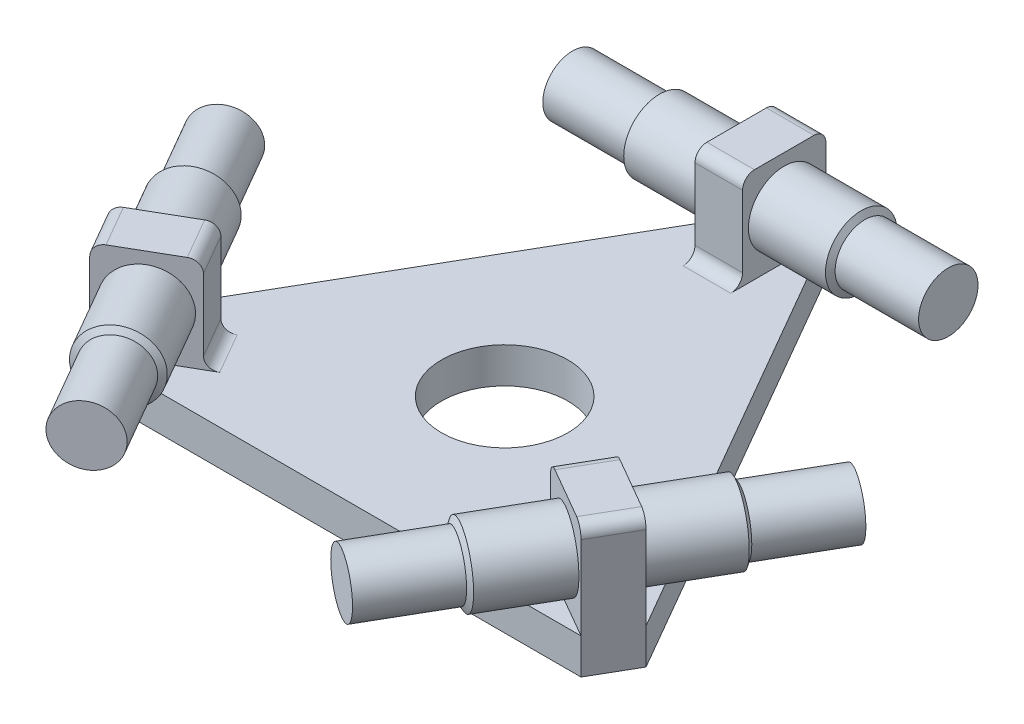
from build123d import *

# Parameters (mm, degrees)
BOSS_EXTRUDE1_DEPTH              = 3.81
F_17_32_0_53125_DIAMETER_HOLE1_D = 13.49375
BOSS_EXTRUDE2_DEPTH              = 10.16
CIRPATTERN19_COUNT               = 3
BOSS_EXTRUDE3_START              = -13.71
SKETCH6_R                        = 3.825
BOSS_EXTRUDE3_DEPTH              = 22.34
BOSS_EXTRUDE4_START              = -31.23
SKETCH7_R                        = 3.175
BOSS_EXTRUDE4_DEPTH              = 40.12
CIRPATTERN21_COUNT               = 3
CIRPATTERN28_COUNT               = 3
CHAMFER3_SIZE                    = 0.4
CHAMFER3_SIZE_2                  = 0.692820323
FILLET4_R                        = 1.27


with BuildPart() as part:
    # Sketch1 → Boss-Extrude1 (new body)
    with BuildSketch(Plane(origin=(0, 0, 0), x_dir=(1, 0, 0), z_dir=(0, 1, 0))):
        Polygon((2.54, 31.75), (-2.54, 31.75), (-28.76630657, -13.675295474), (-26.22630657, -18.074704526), (26.22630657, -18.074704526), (28.76630657, -13.675295474), align=None)
    extrude(amount=BOSS_EXTRUDE1_DEPTH)

    # 17/32 (0.53125) Diameter Hole1 (through all)
    with Locations(Plane(origin=(-6.6e-08, 3.81, -3.86e-07), x_dir=(0, 0, 1), z_dir=(0, 1, 0))):
        with Locations((0, 0)):
            Hole(F_17_32_0_53125_DIAMETER_HOLE1_D / 2)

    # Sketch5 → Boss-Extrude2 (add)
    with BuildSketch(Plane(origin=(0, 3.81, 0), x_dir=(1, 0, 0), z_dir=(0, 1, 0))):
        Polygon((-21.067340731, -9.230295474), (-28.76630657, -13.675295474), (-26.22630657, -18.074704526), (-18.527340731, -13.629704526), align=None)
    boss_extrude2 = extrude(amount=BOSS_EXTRUDE2_DEPTH)

    # CirPattern19: Boss-Extrude2 ×3 about axis
    cirpattern19_axis = Axis((0, 0, 0), (0, 1, 0))
    for i in range(1, CIRPATTERN19_COUNT):
        add(boss_extrude2.rotate(cirpattern19_axis, i * 360 / CIRPATTERN19_COUNT))

    # Sketch6 → Boss-Extrude3 (add)
    with BuildSketch(Plane(origin=(1.27, 0, 2.199704526), x_dir=(0.8660254037844383, 0, -0.5000000000000007), z_dir=(0.5000000000000007, 0, 0.8660254037844383)).offset(BOSS_EXTRUDE3_START)):
        with Locations((-27.305, 8.89)):
            Circle(SKETCH6_R)
    boss_extrude3 = extrude(amount=BOSS_EXTRUDE3_DEPTH)

    # Sketch7 → Boss-Extrude4 (add)
    with BuildSketch(Plane(origin=(5.585, 0, 9.67350376), x_dir=(0.8660254037844384, 0, -0.5000000000000007), z_dir=(0.5000000000000007, 0, 0.8660254037844384)).offset(BOSS_EXTRUDE4_START)):
        with Locations((-27.305, 8.89)):
            Circle(SKETCH7_R)
    boss_extrude4 = extrude(amount=BOSS_EXTRUDE4_DEPTH)

    # CirPattern21: Boss-Extrude3 ×3 about axis
    cirpattern21_axis = Axis((0, 0, 0), (0, 1, 0))
    for i in range(1, CIRPATTERN21_COUNT):
        add(boss_extrude3.rotate(cirpattern21_axis, i * 360 / CIRPATTERN21_COUNT))

    # CirPattern28: Boss-Extrude4 ×3 about axis
    cirpattern28_axis = Axis((0, 0, 0), (0, 1, 0))
    for i in range(1, CIRPATTERN28_COUNT):
        add(boss_extrude4.rotate(cirpattern28_axis, i * 360 / CIRPATTERN28_COUNT))

    # Chamfer3
    # the kernel refuses this chamfer: 0.692820323, 0.4 mm, written as the material it takes off along each edge
    with BuildSketch(Plane(origin=(-18.06182365, 8.89, 23.32600376), x_dir=(0.8660254037844383, 0, -0.5000000000000004), z_dir=(0, -1, 0))) as chamfer3_piece_1_section:
        Polygon((3.825, -CHAMFER3_SIZE), (3.825 - CHAMFER3_SIZE_2, 0), (3.825, 0), align=None)
    chamfer3_piece_1 = revolve(axis=Axis((-18.06182365, 8.89, 23.32600376), (0.5000000000000007, 0, 0.8660254037844383)), mode=Mode.PRIVATE)
    chamfer3_piece_1 = chamfer3_piece_1 - Plane(origin=(-18.164887991, 8.89, 23.147491086), x_dir=(0.8660254037844384, 0, -0.5000000000000007), z_dir=(-0.5000000000000007, 0, -0.8660254037844384)) * Cylinder(3.175, 16, mode=Mode.PRIVATE)
    add(chamfer3_piece_1, mode=Mode.SUBTRACT)
    with BuildSketch(Plane(origin=(-11.17, 8.89, -27.305), x_dir=(0, 0, 1), z_dir=(0, -1, 0))) as chamfer3_piece_2_section:
        Polygon((3.825, -CHAMFER3_SIZE), (3.825 - CHAMFER3_SIZE_2, 0), (3.825, 0), align=None)
    chamfer3_piece_2 = revolve(axis=Axis((-11.17, 8.89, -27.305), (-1, 0, 0)), mode=Mode.PRIVATE)
    chamfer3_piece_2 = chamfer3_piece_2 - Plane(origin=(-10.963871319, 8.89, -27.305), x_dir=(0, 0, 1), z_dir=(1, 0, 0)) * Cylinder(3.175, 16, mode=Mode.PRIVATE)
    add(chamfer3_piece_2, mode=Mode.SUBTRACT)
    with BuildSketch(Plane(origin=(11.17, 8.89, -27.305), x_dir=(0, 0, 1), z_dir=(0, -1, 0))) as chamfer3_piece_3_section:
        Polygon((3.825, CHAMFER3_SIZE), (3.825 - CHAMFER3_SIZE_2, 0), (3.825, 0), align=None)
    chamfer3_piece_3 = revolve(axis=Axis((11.17, 8.89, -27.305), (-1, 0, 0)), mode=Mode.PRIVATE)
    chamfer3_piece_3 = chamfer3_piece_3 - Plane(origin=(10.963871319, 8.89, -27.305), x_dir=(0, 0, 1), z_dir=(1, 0, 0)) * Cylinder(3.175, 16, mode=Mode.PRIVATE)
    add(chamfer3_piece_3, mode=Mode.SUBTRACT)
    with BuildSketch(Plane(origin=(29.23182365, 8.89, 3.97899624), x_dir=(-0.8660254037844392, 0, -0.49999999999999906), z_dir=(0, -1, 0))) as chamfer3_piece_4_section:
        Polygon((3.825, -CHAMFER3_SIZE), (3.825 - CHAMFER3_SIZE_2, 0), (3.825, 0), align=None)
    chamfer3_piece_4 = revolve(axis=Axis((29.23182365, 8.89, 3.97899624), (0.4999999999999995, 0, -0.8660254037844389)), mode=Mode.PRIVATE)
    chamfer3_piece_4 = chamfer3_piece_4 - Plane(origin=(29.12875931, 8.89, 4.157508914), x_dir=(-0.8660254037844389, 0, -0.49999999999999956), z_dir=(-0.49999999999999956, 0, 0.8660254037844389)) * Cylinder(3.175, 16, mode=Mode.PRIVATE)
    add(chamfer3_piece_4, mode=Mode.SUBTRACT)
    with BuildSketch(Plane(origin=(18.06182365, 8.89, 23.32600376), x_dir=(-0.8660254037844394, 0, -0.49999999999999895), z_dir=(0, -1, 0))) as chamfer3_piece_5_section:
        Polygon((3.825, CHAMFER3_SIZE), (3.825 - CHAMFER3_SIZE_2, 0), (3.825, 0), align=None)
    chamfer3_piece_5 = revolve(axis=Axis((18.06182365, 8.89, 23.32600376), (0.4999999999999995, 0, -0.8660254037844389)), mode=Mode.PRIVATE)
    chamfer3_piece_5 = chamfer3_piece_5 - Plane(origin=(18.164887991, 8.89, 23.147491086), x_dir=(-0.8660254037844389, 0, -0.49999999999999956), z_dir=(-0.49999999999999956, 0, 0.8660254037844389)) * Cylinder(3.175, 16, mode=Mode.PRIVATE)
    add(chamfer3_piece_5, mode=Mode.SUBTRACT)
    with BuildSketch(Plane(origin=(-29.23182365, 8.89, 3.97899624), x_dir=(0.8660254037844383, 0, -0.5000000000000004), z_dir=(0, -1, 0))) as chamfer3_piece_6_section:
        Polygon((3.825, CHAMFER3_SIZE), (3.825 - CHAMFER3_SIZE_2, 0), (3.825, 0), align=None)
    chamfer3_piece_6 = revolve(axis=Axis((-29.23182365, 8.89, 3.97899624), (0.5000000000000007, 0, 0.8660254037844383)), mode=Mode.PRIVATE)
    chamfer3_piece_6 = chamfer3_piece_6 - Plane(origin=(-29.12875931, 8.89, 4.157508914), x_dir=(0.8660254037844384, 0, -0.5000000000000007), z_dir=(-0.5000000000000007, 0, -0.8660254037844384)) * Cylinder(3.175, 16, mode=Mode.PRIVATE)
    add(chamfer3_piece_6, mode=Mode.SUBTRACT)

    # Fillet4
    fillet4_edges = [part.edges().sort_by_distance(p)[0] for p in [
        (-19.797340731, 3.81, 11.43),
        (-27.49630657, 13.97, 15.875),
        (-19.797340731, 13.97, 11.43),
        (19.797340731, 3.81, 11.43),
        (27.49630657, 13.97, 15.875),
        (19.797340731, 13.97, 11.43),
        (0, 3.81, -22.86),
        (0, 13.97, -31.75),
        (0, 13.97, -22.86),
    ]]
    fillet(fillet4_edges, radius=FILLET4_R)


solid = part.part
